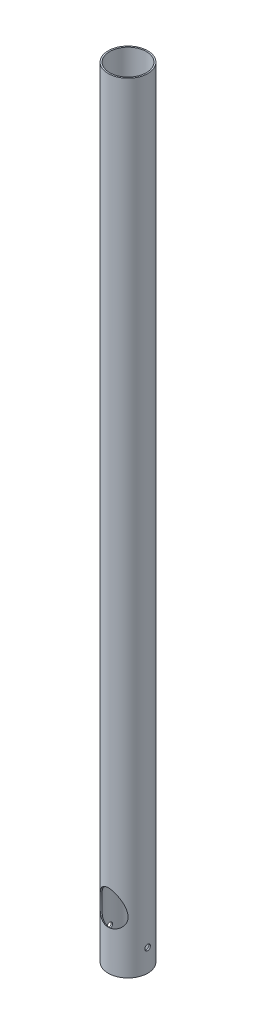
from build123d import *

# Parameters (mm, degrees)
EXTRUDE_1_OUTLINE_R      = 70.5
EXTRUDE_1_OUTLINE_R_2    = 65.5
EXTRUDE_1_DEPTH          = 2780
CUT_EXTRUDE_3_DEPTH      = 2782.787285182
CUT_EXTRUDE_3_DEPTH_BACK = 2782.787285182
SKETCH_6_R               = 10
SKETCH_7_R               = 50
CUT_EXTRUDE_4_DEPTH      = 200
SKETCH_13_R              = 52.5
CUT_EXTRUDE_8_DEPTH      = 200


# Read off the part's stored shape, not the designer's step: Вытянуть-Тонкостенный1
with BuildPart() as part:
    # Вытянуть-Тонкостенный1 outline → Вытянуть-Тонкостенный1 (new body)
    with BuildSketch(Plane(origin=(0, 0, 0), x_dir=(1, 0, 0), z_dir=(0, 1, 0))):
        Circle(EXTRUDE_1_OUTLINE_R)
        Circle(EXTRUDE_1_OUTLINE_R_2, mode=Mode.SUBTRACT)
    extrude(amount=EXTRUDE_1_DEPTH)

    # Эскиз6 → Вырез-Вытянуть3 (cut, two sides: drawn at the far end of the back side and taken through both)
    with BuildSketch(Plane(origin=(0, 0, 0), x_dir=(0, 0, -1), z_dir=(1, 0, 0)).offset(-CUT_EXTRUDE_3_DEPTH_BACK)):
        with Locations((0, 80)):
            Circle(SKETCH_6_R)
    extrude(amount=CUT_EXTRUDE_3_DEPTH + CUT_EXTRUDE_3_DEPTH_BACK, mode=Mode.SUBTRACT)

    # Эскиз7 → Вырез-Вытянуть4 (cut)
    with BuildSketch(Plane(origin=(0, 176.689515805, 252.338779809), x_dir=(1, 0, 0), z_dir=(0, -0.5735764363510416, -0.8191520442889949))):
        with Locations(Location((0, -126.118813858, 0), (0, 0, 90))):
            Circle(SKETCH_7_R)
    extrude(amount=CUT_EXTRUDE_4_DEPTH, mode=Mode.SUBTRACT)

    # Эскиз13 → Вырез-Вытянуть8 (cut)
    with BuildSketch(Plane(origin=(0, 750.265952156, 1071.490824098), x_dir=(1, 0, 0), z_dir=(0, -0.5735764363510416, -0.8191520442889949))):
        with Locations(Location((0, -2185, 0), (0, 0, 270))):
            Circle(SKETCH_13_R)
    extrude(amount=-CUT_EXTRUDE_8_DEPTH, mode=Mode.SUBTRACT)


solid = part.part
